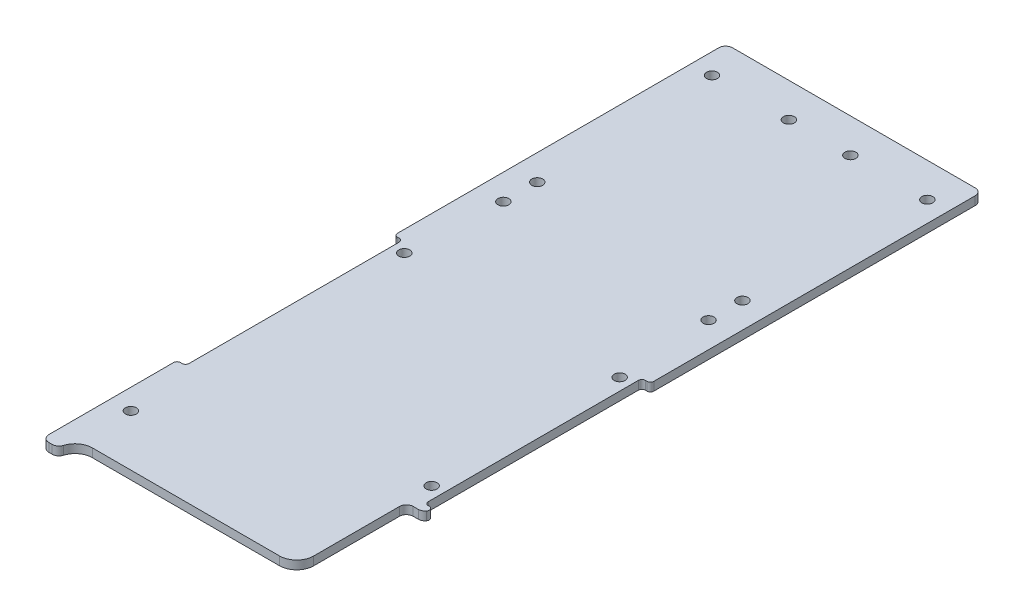
from build123d import *

# Parameters (mm, degrees)
SKETCH1_R               = 2.032
BOSS_EXTRUDE1_DEPTH     = 3.175
FILLET1_R               = 2.54
FILLET2_R               = 2.54
FILLET3_R               = 6.35
CUT_EXTRUDE1_DEPTH      = 136.673215063
FILLET4_R               = 6.35
FILLET5_R               = 2.54
SKETCH3_R               = 2.032
CUT_EXTRUDE2_DEPTH      = 136.673215063
CUT_EXTRUDE3_DEPTH      = 136.673215063
CUT_EXTRUDE3_DEPTH_BACK = 136.673215063
SKETCH4_W               = 3.175
SKETCH4_H               = 80.645
FILLET6_R               = 1.27


with BuildPart() as part:
    # Sketch1 → Boss-Extrude1 (new body)
    with BuildSketch(Plane(origin=(0, 0, 0), x_dir=(1, 0, 0), z_dir=(0, 1, 0))):
        Polygon((47.625, 127), (-47.625, 127), (-47.625, -127), (-41.275, -127), (-41.275, -120.65), (41.275, -120.65), (41.275, -127), (47.625, -127), align=None)
        with Locations((-39.999684148, -101.6)):
            Circle(SKETCH1_R, mode=Mode.SUBTRACT)
        with Locations((39.999684148, -69.85)):
            Circle(SKETCH1_R, mode=Mode.SUBTRACT)
        with Locations((-39.999684148, 0)):
            Circle(SKETCH1_R, mode=Mode.SUBTRACT)
        with Locations((-39.999684148, 114.3)):
            Circle(SKETCH1_R, mode=Mode.SUBTRACT)
        with Locations((-11.424684148, 114.3)):
            Circle(SKETCH1_R, mode=Mode.SUBTRACT)
        with Locations((39.999684148, 0)):
            Circle(SKETCH1_R, mode=Mode.SUBTRACT)
        with Locations((11.424684148, 114.3)):
            Circle(SKETCH1_R, mode=Mode.SUBTRACT)
        with Locations((39.999684148, 114.3)):
            Circle(SKETCH1_R, mode=Mode.SUBTRACT)
    extrude(amount=BOSS_EXTRUDE1_DEPTH)

    # Fillet1
    fillet1_edges = [part.edges().sort_by_distance(p)[0] for p in [
        (-47.625, 1.5875, -127),
        (47.625, 1.5875, -127),
        (47.625, 1.5875, 127),
        (-47.625, 1.5875, 127),
    ]]
    fillet(fillet1_edges, radius=FILLET1_R)

    # Fillet2
    fillet2_edges = [part.edges().sort_by_distance(p)[0] for p in [
        (41.275, 1.5875, 127),
        (-41.275, 1.5875, 127),
    ]]
    fillet(fillet2_edges, radius=FILLET2_R)

    # Fillet3
    fillet3_edges = [part.edges().sort_by_distance(p)[0] for p in [
        (41.275, 1.5875, 120.65),
        (-41.275, 1.5875, 120.65),
    ]]
    fillet(fillet3_edges, radius=FILLET3_R)

    # Sketch2 → Cut-Extrude1 (cut, through all)
    with BuildSketch(Plane.XZ):
        with BuildLine():
            Line((40.64508, 123.578690235), (40.64508, 79.88808))
            Line((40.64508, 79.88808), (47.625, 79.88808))
            Line((47.625, 79.88808), (47.625, 124.46))
            ThreePointArc((47.625, 124.46), (46.881051224, 126.256051224), (45.085, 127))
            Line((45.085, 127), (43.815, 127))
            ThreePointArc((43.815, 127), (42.297059666, 126.496530663), (41.380880287, 125.185714286))
            ThreePointArc((41.380880287, 125.185714286), (41.069166069, 124.356476684), (40.64508, 123.578690235))
        make_face()
    extrude(amount=-CUT_EXTRUDE1_DEPTH, mode=Mode.SUBTRACT)

    # Fillet4
    fillet4_edges = [part.edges().sort_by_distance(p)[0] for p in [
        (40.64508, 1.5875, 123.578690235),
    ]]
    fillet(fillet4_edges, radius=FILLET4_R)

    # Fillet5
    fillet5_edges = [part.edges().sort_by_distance(p)[0] for p in [
        (47.625, 1.5875, 79.88808),
        (40.64508, 1.5875, 79.88808),
    ]]
    fillet(fillet5_edges, radius=FILLET5_R)

    # Sketch3 → Cut-Extrude2 (cut, through all)
    with BuildSketch(Plane.XZ):
        with Locations((-38.108488759, -34.913768806)):
            Circle(SKETCH3_R)
        with Locations((-38.108488759, -47.490173279)):
            Circle(SKETCH3_R)
        with Locations((38.108488759, -47.490173279)):
            Circle(SKETCH3_R)
        with Locations((38.108488759, -34.913768806)):
            Circle(SKETCH3_R)
    extrude(amount=-CUT_EXTRUDE2_DEPTH, mode=Mode.SUBTRACT)

    # Sketch4 → Cut-Extrude3 (cut, two sides: drawn at the far end of the back side and taken through both)
    with BuildSketch(Plane(origin=(0, 3.175, 0), x_dir=(1, 0, 0), z_dir=(0, 1, 0)).offset(-CUT_EXTRUDE3_DEPTH_BACK)):
        with Locations((-46.0375, -36.5125)):
            Rectangle(SKETCH4_W, SKETCH4_H)
        with Locations((46.0375, -36.5125)):
            Rectangle(SKETCH4_W, SKETCH4_H)
    extrude(amount=CUT_EXTRUDE3_DEPTH + CUT_EXTRUDE3_DEPTH_BACK, mode=Mode.SUBTRACT)

    # Fillet6
    fillet6_edges = [part.edges().sort_by_distance(p)[0] for p in [
        (-44.45, 1.5875, -3.81),
        (-47.625, 1.5875, -3.81),
        (-47.625, 1.5875, 76.835),
        (-44.45, 1.5875, 76.835),
        (44.45, 1.5875, 76.835),
        (47.625, 1.5875, 76.835),
        (44.45, 1.5875, -3.81),
        (47.625, 1.5875, -3.81),
    ]]
    fillet(fillet6_edges, radius=FILLET6_R)


solid = part.part
